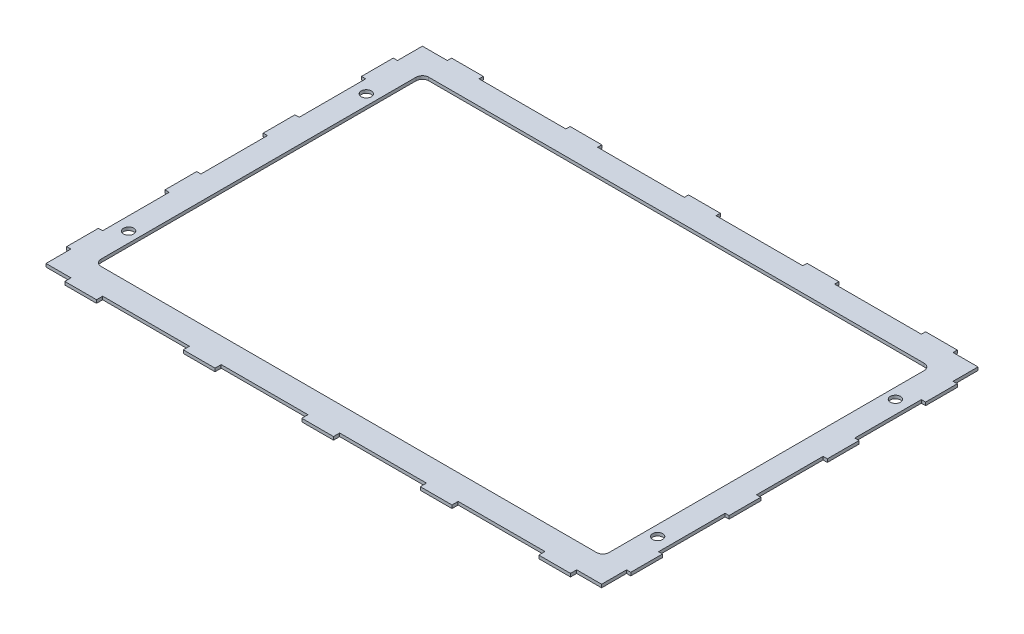
from build123d import *

# Parameters (mm, degrees)
SKETCH1_W           = 438.5
SKETCH1_H           = 297.3
BASE_FLANGE1_DEPTH  = 2.5
SKETCH6_W           = 3
SKETCH6_H           = 25
BOSS_EXTRUDE1_DEPTH = 2.5
SKETCH8_W           = 25
SKETCH8_H           = 4.5
BOSS_EXTRUDE2_DEPTH = 2.5
SKETCH9_W           = 25
SKETCH9_H           = 3
BOSS_EXTRUDE3_DEPTH = 2.5
SKETCH10_W          = 0.35
SKETCH10_H          = 19.65
SKETCH10_W_2        = 20
SKETCH10_H_2        = 0.35
SKETCH10_H_3        = 52.4334
SKETCH10_H_4        = 20
SKETCH10_W_3        = 19.65
SKETCH10_W_4        = 68.375
SKETCH10_W_5        = 0.125
SKETCH10_H_5        = 52.4333
CUT_EXTRUDE1_DEPTH  = 10
SKETCH11_R          = 4
CUT_EXTRUDE2_DEPTH  = 3.05


# Sheet-metal steps are written as plain solids
with BuildPart() as part:
    # Sketch1 → Base-Flange1 (new body)
    with BuildSketch(Plane(origin=(0, 0, 0), x_dir=(1, 0, 0), z_dir=(0, 1, 0))):
        Rectangle(SKETCH1_W, SKETCH1_H)
        with BuildLine():
            Line((-195.2, 129.6), (195.2, 129.6))
            ThreePointArc((195.2, 129.6), (198.735533906, 128.135533906), (200.2, 124.6))
            Line((200.2, 124.6), (200.2, -123.65))
            ThreePointArc((200.2, -123.65), (198.735533906, -127.185533906), (195.2, -128.65))
            Line((195.2, -128.65), (-195.2, -128.65))
            ThreePointArc((-195.2, -128.65), (-198.735533906, -127.185533906), (-200.2, -123.65))
            Line((-200.2, -123.65), (-200.2, 124.6))
            ThreePointArc((-200.2, 124.6), (-198.735533906, 128.135533906), (-195.2, 129.6))
        make_face(mode=Mode.SUBTRACT)
    extrude(amount=-BASE_FLANGE1_DEPTH)

    # Sketch6 → Boss-Extrude1 (add)
    with BuildSketch(Plane(origin=(0, 0, 0), x_dir=(1, 0, 0), z_dir=(0, 1, 0))):
        with Locations((220.75, -116.15)):
            Rectangle(SKETCH6_W, SKETCH6_H)
        with Locations((220.75, -38.7166)):
            Rectangle(SKETCH6_W, SKETCH6_H)
        with Locations((220.75, 38.7167)):
            Rectangle(SKETCH6_W, SKETCH6_H)
        with Locations((220.75, 116.15)):
            Rectangle(SKETCH6_W, SKETCH6_H)
    boss_extrude1 = extrude(amount=-BOSS_EXTRUDE1_DEPTH)

    # Mirror1: Boss-Extrude1 across plane
    add(boss_extrude1.mirror(Plane(origin=(0, 0, 0), x_dir=(0, 0, 1), z_dir=(1, 0, 0))))

    # Sketch8 → Boss-Extrude2 (add)
    with BuildSketch(Plane(origin=(0, 0, 0), x_dir=(1, 0, 0), z_dir=(0, 1, 0))):
        with Locations((-186.75, -150.9)):
            Rectangle(SKETCH8_W, SKETCH8_H)
        with Locations((93.375, -150.9)):
            Rectangle(SKETCH8_W, SKETCH8_H)
        with Locations((-93.375, -150.9)):
            Rectangle(SKETCH8_W, SKETCH8_H)
        with Locations((0, -150.9)):
            Rectangle(SKETCH8_W, SKETCH8_H)
        with Locations((186.75, -150.9)):
            Rectangle(SKETCH8_W, SKETCH8_H)
    extrude(amount=-BOSS_EXTRUDE2_DEPTH)

    # Sketch9 → Boss-Extrude3 (add)
    with BuildSketch(Plane(origin=(0, 0, 0), x_dir=(1, 0, 0), z_dir=(0, 1, 0))):
        with Locations((-186.75, 150.15)):
            Rectangle(SKETCH9_W, SKETCH9_H)
        with Locations((-93.375, 150.15)):
            Rectangle(SKETCH9_W, SKETCH9_H)
        with Locations((0, 150.15)):
            Rectangle(SKETCH9_W, SKETCH9_H)
        with Locations((93.375, 150.15)):
            Rectangle(SKETCH9_W, SKETCH9_H)
        with Locations((186.75, 150.15)):
            Rectangle(SKETCH9_W, SKETCH9_H)
    extrude(amount=-BOSS_EXTRUDE3_DEPTH)

    # Sketch10 → Cut-Extrude1 (cut)
    with BuildSketch(Plane(origin=(0, 0, 0), x_dir=(1, 0, 0), z_dir=(0, 1, 0))):
        with Locations((219.075, 138.475)):
            Rectangle(SKETCH10_W, SKETCH10_H)
        with Locations((209.25, 148.475)):
            Rectangle(SKETCH10_W_2, SKETCH10_H_2)
        with Locations((-219.075, -77.4333)):
            Rectangle(SKETCH10_W, SKETCH10_H_3)
        with Locations((-219.075, -138.65)):
            Rectangle(SKETCH10_W, SKETCH10_H_4)
        with Locations((-209.075, -148.475)):
            Rectangle(SKETCH10_W_3, SKETCH10_H_2)
        with Locations((-140.0625, -148.475)):
            Rectangle(SKETCH10_W_4, SKETCH10_H_2)
        with Locations((-46.6875, -148.475)):
            Rectangle(SKETCH10_W_4, SKETCH10_H_2)
        with Locations((46.6875, -148.475)):
            Rectangle(SKETCH10_W_4, SKETCH10_H_2)
        with Locations((140.0625, -148.475)):
            Rectangle(SKETCH10_W_4, SKETCH10_H_2)
        with Locations((209.25, -148.475)):
            Rectangle(SKETCH10_W_2, SKETCH10_H_2)
        with Locations((219.075, -138.475)):
            Rectangle(SKETCH10_W, SKETCH10_H)
        with Locations((219.1875, -77.4333)):
            Rectangle(SKETCH10_W_5, SKETCH10_H_3)
        with Locations((219.075, 5e-05)):
            Rectangle(SKETCH10_W, SKETCH10_H_5)
        with Locations((219.075, 77.43335)):
            Rectangle(SKETCH10_W, SKETCH10_H_5)
        with Locations((140.0625, 148.475)):
            Rectangle(SKETCH10_W_4, SKETCH10_H_2)
        with Locations((46.6875, 148.475)):
            Rectangle(SKETCH10_W_4, SKETCH10_H_2)
        with Locations((-46.6875, 148.475)):
            Rectangle(SKETCH10_W_4, SKETCH10_H_2)
        with Locations((-209.25, 148.475)):
            Rectangle(SKETCH10_W_2, SKETCH10_H_2)
        with Locations((-140.0625, 148.475)):
            Rectangle(SKETCH10_W_4, SKETCH10_H_2)
        with Locations((-219.075, 138.475)):
            Rectangle(SKETCH10_W, SKETCH10_H)
        with Locations((-219.075, 77.43335)):
            Rectangle(SKETCH10_W, SKETCH10_H_5)
        with Locations((-219.075, 5e-05)):
            Rectangle(SKETCH10_W, SKETCH10_H_5)
    extrude(amount=-CUT_EXTRUDE1_DEPTH, mode=Mode.SUBTRACT)

    # Sketch11 → Cut-Extrude2 (cut)
    with BuildSketch(Plane(origin=(0, 0, 0), x_dir=(1, 0, 0), z_dir=(0, 1, 0))):
        with Locations(Location((-208.44992, 93.649, 0), (0, 0, 270))):
            Circle(SKETCH11_R)
        with Locations(Location((208.44992, 93.649, 0), (0, 0, 270))):
            Circle(SKETCH11_R)
        with Locations(Location((208.44992, -93.649, 0), (0, 0, 270))):
            Circle(SKETCH11_R)
        with Locations(Location((-208.44992, -93.649, 0), (0, 0, 270))):
            Circle(SKETCH11_R)
    extrude(amount=-CUT_EXTRUDE2_DEPTH, mode=Mode.SUBTRACT)


solid = part.part
